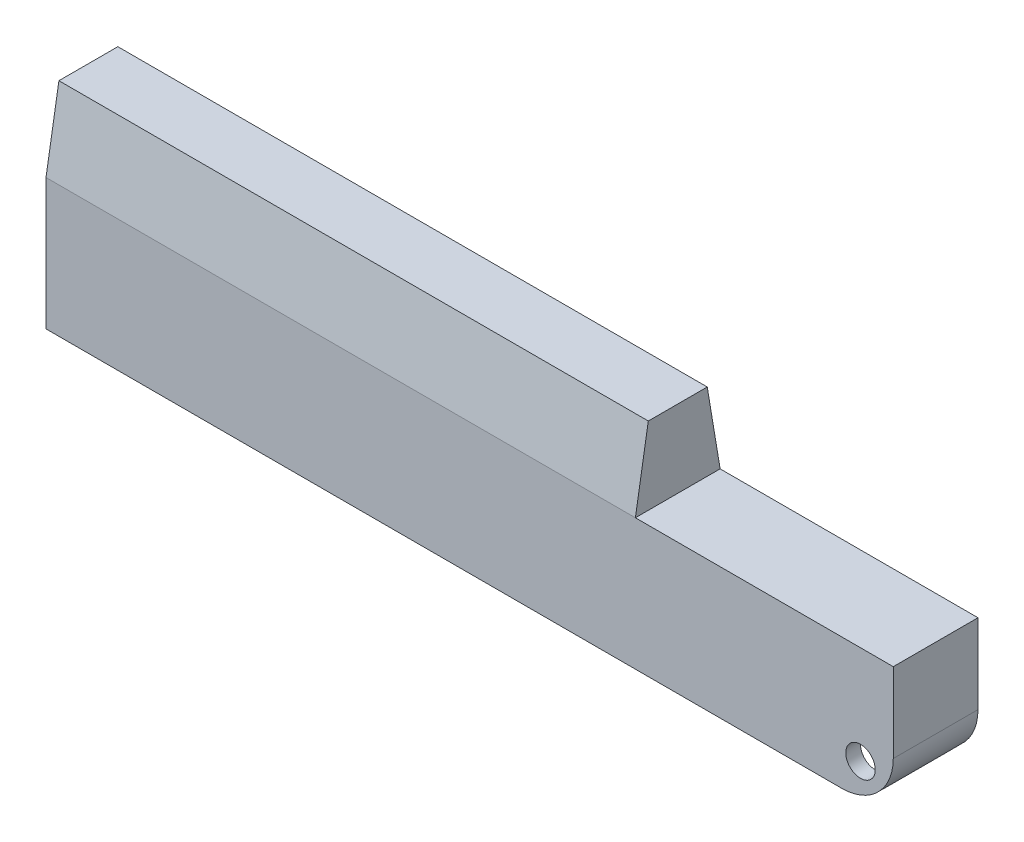
from build123d import *

# Parameters (mm, degrees)
SKETCH1_W           = 138
SKETCH1_H           = 11.5
BOSS_EXTRUDE1_DEPTH = 17.8
SKETCH8_R           = 2
CUT_EXTRUDE4_DEPTH  = 11.5
SKETCH11_W          = 23
SKETCH11_H          = 11.5
CUT_EXTRUDE5_DEPTH  = 17.8
SKETCH14_W          = 80
SKETCH14_H          = 11.5
BOSS_EXTRUDE4_DEPTH = 10.5
CHAMFER1_SIZE       = 10.5
CHAMFER1_SIZE2      = 1.75
CHAMFER2_SIZE       = 10.5
CHAMFER2_SIZE2      = 1.75
SKETCH12_W          = 111
SKETCH12_H          = 7.5
CUT_EXTRUDE6_DEPTH  = 9.8
SKETCH13_W          = 55.5
SKETCH13_H          = 2
BOSS_EXTRUDE3_DEPTH = 7.5
FILLET1_R           = 7


with BuildPart() as part:
    # Sketch1 → Boss-Extrude1 (new body)
    with BuildSketch(Plane(origin=(0, 0, 0), x_dir=(1, 0, 0), z_dir=(0, 1, 0))):
        Rectangle(SKETCH1_W, SKETCH1_H)
    extrude(amount=-BOSS_EXTRUDE1_DEPTH)

    # Sketch8 → Cut-Extrude4 (cut)
    with BuildSketch(Plane.XY.offset(5.75)):
        with Locations((64.55, -13.35)):
            Circle(SKETCH8_R)
    extrude(amount=-CUT_EXTRUDE4_DEPTH, mode=Mode.SUBTRACT)

    # Sketch11 → Cut-Extrude5 (cut)
    with BuildSketch(Plane.XZ.offset(17.8)):
        with Locations((-57.5, 0)):
            Rectangle(SKETCH11_W, SKETCH11_H)
    extrude(amount=-CUT_EXTRUDE5_DEPTH, mode=Mode.SUBTRACT)

    # Sketch14 → Boss-Extrude4 (add)
    with BuildSketch(Plane(origin=(0, 0, 0), x_dir=(1, 0, 0), z_dir=(0, 1, 0))):
        with Locations((-6, 0)):
            Rectangle(SKETCH14_W, SKETCH14_H)
    extrude(amount=BOSS_EXTRUDE4_DEPTH)

    # Chamfer1
    chamfer1_edges = [part.edges().sort_by_distance(p)[0] for p in [
        (-6, 10.5, 5.75),
    ]]
    chamfer1_side = [part.faces().sort_by_distance(p)[0] for p in [
        (6.154026517, -4.745470138, 5.75),
    ]]
    chamfer(chamfer1_edges, length=CHAMFER1_SIZE, length2=CHAMFER1_SIZE2, reference=chamfer1_side[0])

    # Chamfer2
    chamfer2_edges = [part.edges().sort_by_distance(p)[0] for p in [
        (-6, 10.5, -5.75),
    ]]
    chamfer2_side = [part.faces().sort_by_distance(p)[0] for p in [
        (6.154026517, -4.745470138, -5.75),
    ]]
    chamfer(chamfer2_edges, length=CHAMFER2_SIZE, length2=CHAMFER2_SIZE2, reference=chamfer2_side[0])

    # Sketch12 → Cut-Extrude6 (cut)
    with BuildSketch(Plane.XZ.offset(17.8)):
        with Locations((11.5, 0)):
            Rectangle(SKETCH12_W, SKETCH12_H)
    extrude(amount=-CUT_EXTRUDE6_DEPTH, mode=Mode.SUBTRACT)

    # Sketch13 → Boss-Extrude3 (add)
    with BuildSketch(Plane.XY.offset(-3.75)):
        with Locations((-16.25, -13.3)):
            Rectangle(SKETCH13_W, SKETCH13_H)
    extrude(amount=BOSS_EXTRUDE3_DEPTH)

    # Fillet1
    # the kernel refuses this fillet: 7 mm, written as the material it takes off along each edge
    with BuildSketch(Plane(origin=(69, -17.8, 23.25), x_dir=(-1, 0, 0), z_dir=(0, 0, -1))) as fillet1_piece_1:
        with BuildLine():
            CenterArc((FILLET1_R, FILLET1_R), FILLET1_R, 180, 90)
            Line((0, FILLET1_R), (0, 0))
            Line((0, 0), (FILLET1_R, 0))
        make_face()
    extrude(amount=46.5, mode=Mode.SUBTRACT)


solid = part.part
